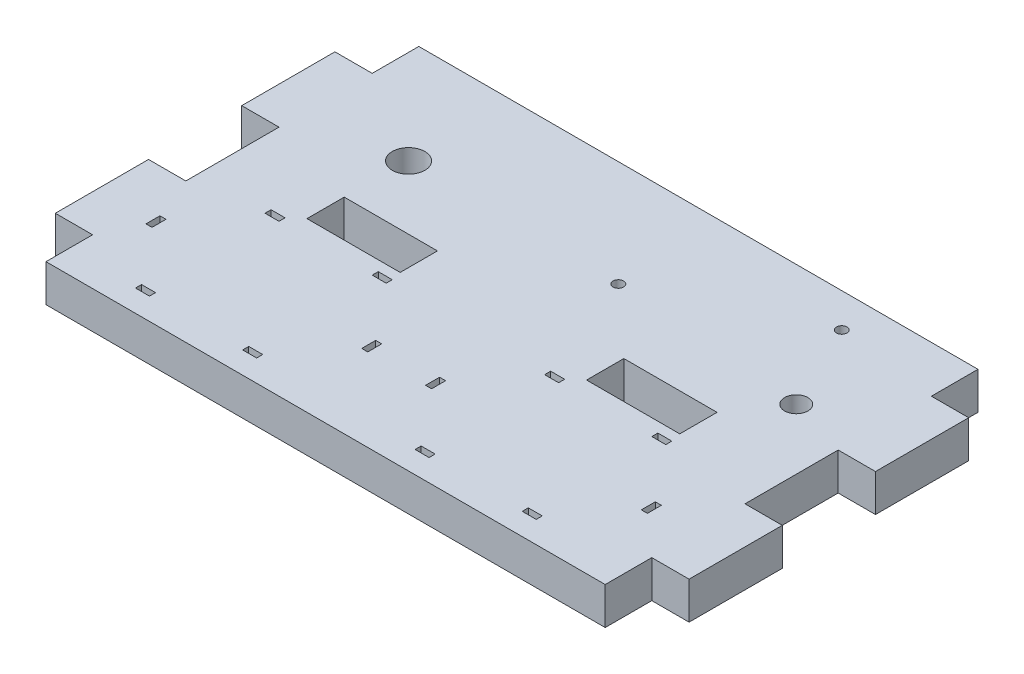
from build123d import *

# Parameters (mm, degrees)
SKETCH1_W           = 120
SKETCH1_H           = 80
SKETCH1_R           = 3.5
SKETCH1_R_2         = 2.5
SKETCH1_R_3         = 1.13
SKETCH1_W_2         = 3
SKETCH1_H_2         = 1.3
SKETCH1_W_3         = 1.3
SKETCH1_H_3         = 3
BOSS_EXTRUDE1_DEPTH = 8
CUT_EXTRUDE1_DEPTH  = 4
CUT_EXTRUDE2_REACH  = 74.553
SKETCH3_W           = 20
SKETCH3_H           = 8
SKETCH4_W           = 20
SKETCH4_H           = 8
BOSS_EXTRUDE2_DEPTH = 8


with BuildPart() as part:
    # Sketch1 → Boss-Extrude1 (new body)
    with BuildSketch(Plane(origin=(0, 0, 0), x_dir=(1, 0, 0), z_dir=(0, 1, 0))):
        Rectangle(SKETCH1_W, SKETCH1_H)
        with Locations((-39.823045535, 17.627318551)):
            Circle(SKETCH1_R, mode=Mode.SUBTRACT)
        with Locations((47, 14)):
            Circle(SKETCH1_R_2, mode=Mode.SUBTRACT)
        with Locations((38.07, 32.68)):
            Circle(SKETCH1_R_3, mode=Mode.SUBTRACT)
        with Locations((5.56, 17.26)):
            Circle(SKETCH1_R_3, mode=Mode.SUBTRACT)
        with Locations((16, -34.65)):
            Rectangle(SKETCH1_W_2, SKETCH1_H_2, mode=Mode.SUBTRACT)
        with Locations((16, -6.85)):
            Rectangle(SKETCH1_W_2, SKETCH1_H_2, mode=Mode.SUBTRACT)
        with Locations((39, -6.85)):
            Rectangle(SKETCH1_W_2, SKETCH1_H_2, mode=Mode.SUBTRACT)
        with Locations((39, -34.65)):
            Rectangle(SKETCH1_W_2, SKETCH1_H_2, mode=Mode.SUBTRACT)
        with Locations((50.65, -20.75)):
            Rectangle(SKETCH1_W_3, SKETCH1_H_3, mode=Mode.SUBTRACT)
        with Locations((4.35, -20.75)):
            Rectangle(SKETCH1_W_3, SKETCH1_H_3, mode=Mode.SUBTRACT)
        with Locations((-55.65, -20.75)):
            Rectangle(SKETCH1_W_3, SKETCH1_H_3, mode=Mode.SUBTRACT)
        with Locations((-9.35, -20.75)):
            Rectangle(SKETCH1_W_3, SKETCH1_H_3, mode=Mode.SUBTRACT)
        with Locations((-44, -34.65)):
            Rectangle(SKETCH1_W_2, SKETCH1_H_2, mode=Mode.SUBTRACT)
        with Locations((-44, -6.85)):
            Rectangle(SKETCH1_W_2, SKETCH1_H_2, mode=Mode.SUBTRACT)
        with Locations((-21, -34.65)):
            Rectangle(SKETCH1_W_2, SKETCH1_H_2, mode=Mode.SUBTRACT)
        with Locations((-21, -6.85)):
            Rectangle(SKETCH1_W_2, SKETCH1_H_2, mode=Mode.SUBTRACT)
    extrude(amount=BOSS_EXTRUDE1_DEPTH)

    # Sketch2 → Cut-Extrude1 (cut)
    with BuildSketch(Plane.XZ):
        Polygon((7.869401077, -17.26), (6.714700538, -15.26), (4.405299462, -15.26), (3.250598923, -17.26), (4.405299462, -19.26), (6.714700538, -19.26), align=None)
        Polygon((40.379401077, -32.68), (39.224700538, -30.68), (36.915299462, -30.68), (35.760598923, -32.68), (36.915299462, -34.68), (39.224700538, -34.68), align=None)
    extrude(amount=-CUT_EXTRUDE1_DEPTH, mode=Mode.SUBTRACT)

    # Sketch3 → Cut-Extrude2 (cut, up to next)
    with BuildSketch(Plane.XZ, mode=Mode.PRIVATE) as cut_extrude2_sk1:
        with Locations((-30, 0)):
            Rectangle(SKETCH3_W, SKETCH3_H)
    cut_extrude2_tool1 = extrude(cut_extrude2_sk1.sketch, amount=-CUT_EXTRUDE2_REACH, mode=Mode.PRIVATE) & part.part
    cut_extrude2 = cut_extrude2_tool1.solids().sort_by_distance((-30, 0, 0))[0]
    add(cut_extrude2, mode=Mode.SUBTRACT)

    # Mirror1: Cut-Extrude2 across plane
    add(cut_extrude2.mirror(Plane.ZY), mode=Mode.SUBTRACT)

    # Sketch4 → Boss-Extrude2 (add)
    with BuildSketch(Plane.ZY.offset(60)):
        with Locations((20, 4)):
            Rectangle(SKETCH4_W, SKETCH4_H)
        with Locations((-20, 4)):
            Rectangle(SKETCH4_W, SKETCH4_H)
    boss_extrude2 = extrude(amount=BOSS_EXTRUDE2_DEPTH)

    # Mirror2: Boss-Extrude2 across plane
    add(boss_extrude2.mirror(Plane.ZY))


solid = part.part
